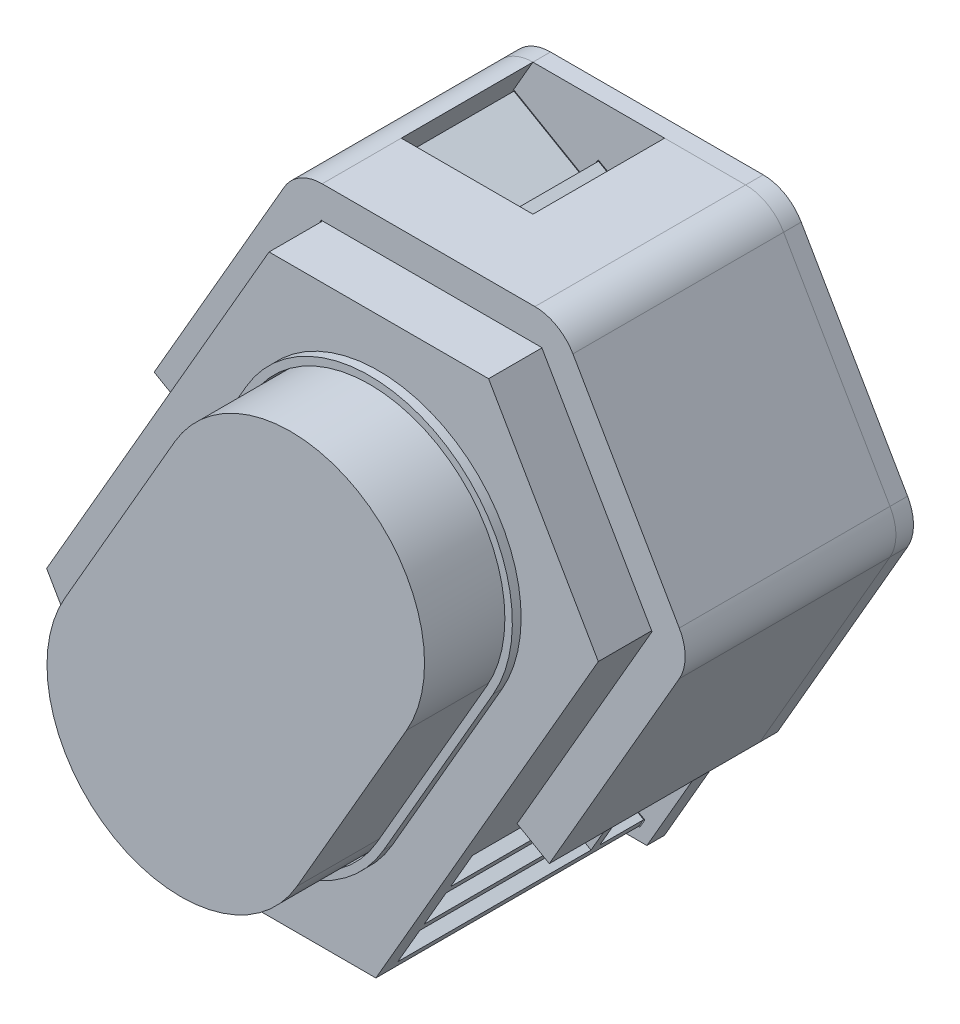
from build123d import *

# Parameters (mm, degrees)
BOSS_EXTRUDE1_DEPTH         = 60
SHELL1_T                    = -3
CUT_EXTRUDE1_REACH          = 436.199
SKETCH9_W                   = 10
SKETCH9_H                   = 44
SKETCH9_H_2                 = 10
CUT_EXTRUDE2_REACH          = 317.512
SKETCH10_W                  = 10
SKETCH10_H                  = 44
SKETCH10_H_2                = 10
CUT_EXTRUDE3_REACH          = 238.706
SKETCH11_W                  = 10
SKETCH11_H                  = 44
SKETCH11_H_2                = 10
BOSS_EXTRUDE8_START         = -60
BOSS_EXTRUDE8_DEPTH         = 48
FILLET2_R                   = 10
MOVE_FACE2_DEPTH            = 48
BOSS_EXTRUDE6_DEPTH         = 2
CUT_EXTRUDE4_DEPTH          = 30
MOVE_FACE3_BY               = 0.2
BOSS_EXTRUDE9_REACH         = 441.997
MOVE_FACE4_BY               = 0.2
MOVE_FACE5_BY               = 27
BOSS_EXTRUDE7_DEPTH         = 18
BOSS_EXTRUDE7_DEPTH_BACK    = 62
BODY_MOVE_COPY2_DEPTH       = 80
MOVE_START                  = -0.3
MOVE_FACE1_DEPTH            = 80.6
SHELL4_DEPTH                = 77
BOSS_EXTRUDE10_DEPTH        = 4
FILLET3_R                   = 10
MOVE_START_2                = -4
MOVE_FACE6_DEPTH            = 4
BOSS_EXTRUDE11_DEPTH        = 2
BOSS_EXTRUDE11_2_DEPTH      = 2
BOSS_EXTRUDE11_3_OUTLINE_W  = 2
BOSS_EXTRUDE11_3_OUTLINE_H  = 3
BOSS_EXTRUDE11_3_DEPTH      = 2
BOSS_EXTRUDE11_4_DEPTH      = 2
BOSS_EXTRUDE11_5_DEPTH      = 2
BOSS_EXTRUDE11_6_DEPTH      = 2
BOSS_EXTRUDE11_7_DEPTH      = 2
BOSS_EXTRUDE11_8_DEPTH      = 2
BOSS_EXTRUDE11_9_DEPTH      = 2
BOSS_EXTRUDE11_10_DEPTH     = 2
BOSS_EXTRUDE11_11_OUTLINE_W = 2
BOSS_EXTRUDE11_11_OUTLINE_H = 3
BOSS_EXTRUDE11_11_DEPTH     = 2
BOSS_EXTRUDE11_12_OUTLINE_W = 2
BOSS_EXTRUDE11_12_OUTLINE_H = 3
BOSS_EXTRUDE11_12_DEPTH     = 2
BOSS_EXTRUDE11_13_DEPTH     = 2
BOSS_EXTRUDE11_14_DEPTH     = 2
BOSS_EXTRUDE11_15_DEPTH     = 2
MOVE_START_3                = -315.983573027
MOVE_FACE7_OUTLINE_W        = 3.4
MOVE_FACE7_OUTLINE_H        = 2
MOVE_FACE7_DEPTH            = 2.4
MOVE_START_4                = -2
MOVE_FACE7_2_DEPTH          = 2
MOVE_START_5                = -150.955362411
MOVE_FACE7_3_OUTLINE_W      = 3.4
MOVE_FACE7_3_OUTLINE_H      = 2
MOVE_FACE7_3_DEPTH          = 2.4
MOVE_START_6                = -13.898877476
MOVE_FACE7_4_OUTLINE_W      = 2.4
MOVE_FACE7_4_OUTLINE_H      = 2
MOVE_FACE7_4_DEPTH          = 3.4
MOVE_START_7                = -339.983573027
MOVE_FACE7_5_OUTLINE_W      = 3.4
MOVE_FACE7_5_OUTLINE_H      = 2
MOVE_FACE7_5_DEPTH          = 2.4
MOVE_FACE7_6_DEPTH          = 2
MOVE_START_8                = 175.828210615
MOVE_FACE7_7_OUTLINE_W      = 3.4
MOVE_FACE7_7_OUTLINE_H      = 2
MOVE_FACE7_7_DEPTH          = 2.4
MOVE_START_9                = -311.702949613
MOVE_FACE7_8_OUTLINE_W      = 2.4
MOVE_FACE7_8_OUTLINE_H      = 2
MOVE_FACE7_8_DEPTH          = 3.4
MOVE_FACE7_9_DEPTH          = 2
MOVE_FACE7_10_DEPTH         = 2
MOVE_START_10               = -138.955362411
MOVE_FACE7_11_OUTLINE_W     = 3.4
MOVE_FACE7_11_OUTLINE_H     = 2
MOVE_FACE7_11_DEPTH         = 2.4
MOVE_START_11               = -126.955362411
MOVE_FACE7_12_OUTLINE_W     = 3.4
MOVE_FACE7_12_OUTLINE_H     = 2
MOVE_FACE7_12_DEPTH         = 2.4
MOVE_FACE7_13_DEPTH         = 2
MOVE_FACE7_14_OUTLINE_W     = 3.4
MOVE_FACE7_14_OUTLINE_H     = 2
MOVE_FACE7_14_DEPTH         = 2.4
MOVE_START_12               = -228.100409235
MOVE_FACE7_15_OUTLINE_W     = 2.4
MOVE_FACE7_15_OUTLINE_H     = 2
MOVE_FACE7_15_DEPTH         = 3.4


# Read off the part's stored shape, not the designer's step: Boss-Extrude8, Move Face2, Body-Move/Copy2, Move Face1, Shell4, Move Face6, Boss-Extrude11, Move Face7
with BuildPart() as part:
    # Sketch1 → Boss-Extrude1 (new body)
    with BuildSketch(Plane(origin=(0, 0, 0), x_dir=(0, 1, 0), z_dir=(0, 0, 1))):
        Polygon((254.502801948, 162.755362411), (297.804072137, 187.755362411), (332.445088288, 167.755362411), (385.566866553, 137.08548943), (385.566866553, 87.08548943), (342.265596364, 62.08548943), (289.143818099, 92.755362411), (254.502801948, 112.755362411), align=None)
    extrude(amount=BOSS_EXTRUDE1_DEPTH)

    # Shell1
    shell1_openings = [part.faces().sort_by_distance(p)[0] for p in [
        (-124.920425921, 320.03483425, 0),
    ]]
    offset(amount=SHELL1_T, openings=shell1_openings, kind=Kind.INTERSECTION)

    # Sketch9 → Cut-Extrude1 (cut, up to next)
    with BuildSketch(Plane(origin=(-11.863575898, -6.849438738, 0), x_dir=(0.5000000000000064, -0.8660254037844349, 0), z_dir=(-0.8660254037844349, -0.5000000000000064, 0)), mode=Mode.PRIVATE) as cut_extrude1_sk1:
        with Locations((-344.783573027, 34)):
            Rectangle(SKETCH9_W, SKETCH9_H)
    cut_extrude1_tool1 = extrude(cut_extrude1_sk1.sketch, amount=-CUT_EXTRUDE1_REACH, mode=Mode.PRIVATE) & part.part
    # Sketch9 → Cut-Extrude1 (cut, up to next)
    with BuildSketch(Plane(origin=(-11.863575898, -6.849438738, 0), x_dir=(0.5000000000000064, -0.8660254037844349, 0), z_dir=(-0.8660254037844349, -0.5000000000000064, 0)), mode=Mode.PRIVATE) as cut_extrude1_sk2:
        with Locations((-332.783573027, 34)):
            Rectangle(SKETCH9_W, SKETCH9_H)
    cut_extrude1_tool2 = extrude(cut_extrude1_sk2.sketch, amount=-CUT_EXTRUDE1_REACH, mode=Mode.PRIVATE) & part.part
    # Sketch9 → Cut-Extrude1 (cut, up to next)
    with BuildSketch(Plane(origin=(-11.863575898, -6.849438738, 0), x_dir=(0.5000000000000064, -0.8660254037844349, 0), z_dir=(-0.8660254037844349, -0.5000000000000064, 0)), mode=Mode.PRIVATE) as cut_extrude1_sk3:
        with Locations((-320.783573027, 34)):
            Rectangle(SKETCH9_W, SKETCH9_H)
    cut_extrude1_tool3 = extrude(cut_extrude1_sk3.sketch, amount=-CUT_EXTRUDE1_REACH, mode=Mode.PRIVATE) & part.part
    # Sketch9 → Cut-Extrude1 (cut, up to next)
    with BuildSketch(Plane(origin=(-11.863575898, -6.849438738, 0), x_dir=(0.5000000000000064, -0.8660254037844349, 0), z_dir=(-0.8660254037844349, -0.5000000000000064, 0)), mode=Mode.PRIVATE) as cut_extrude1_sk4:
        with Locations((-308.783573027, 34)):
            Rectangle(SKETCH9_W, SKETCH9_H)
    cut_extrude1_tool4 = extrude(cut_extrude1_sk4.sketch, amount=-CUT_EXTRUDE1_REACH, mode=Mode.PRIVATE) & part.part
    # Sketch9 → Cut-Extrude1 (cut, up to next)
    with BuildSketch(Plane(origin=(-11.863575898, -6.849438738, 0), x_dir=(0.5000000000000064, -0.8660254037844349, 0), z_dir=(-0.8660254037844349, -0.5000000000000064, 0)), mode=Mode.PRIVATE) as cut_extrude1_sk5:
        with Locations((-344.783573027, 5)):
            Rectangle(SKETCH9_W, SKETCH9_H_2)
    cut_extrude1_tool5 = extrude(cut_extrude1_sk5.sketch, amount=-CUT_EXTRUDE1_REACH, mode=Mode.PRIVATE) & part.part
    # Sketch9 → Cut-Extrude1 (cut, up to next)
    with BuildSketch(Plane(origin=(-11.863575898, -6.849438738, 0), x_dir=(0.5000000000000064, -0.8660254037844349, 0), z_dir=(-0.8660254037844349, -0.5000000000000064, 0)), mode=Mode.PRIVATE) as cut_extrude1_sk6:
        with Locations((-332.783573027, 5)):
            Rectangle(SKETCH9_W, SKETCH9_H_2)
    cut_extrude1_tool6 = extrude(cut_extrude1_sk6.sketch, amount=-CUT_EXTRUDE1_REACH, mode=Mode.PRIVATE) & part.part
    # Sketch9 → Cut-Extrude1 (cut, up to next)
    with BuildSketch(Plane(origin=(-11.863575898, -6.849438738, 0), x_dir=(0.5000000000000064, -0.8660254037844349, 0), z_dir=(-0.8660254037844349, -0.5000000000000064, 0)), mode=Mode.PRIVATE) as cut_extrude1_sk7:
        with Locations((-320.783573027, 5)):
            Rectangle(SKETCH9_W, SKETCH9_H_2)
    cut_extrude1_tool7 = extrude(cut_extrude1_sk7.sketch, amount=-CUT_EXTRUDE1_REACH, mode=Mode.PRIVATE) & part.part
    # Sketch9 → Cut-Extrude1 (cut, up to next)
    with BuildSketch(Plane(origin=(-11.863575898, -6.849438738, 0), x_dir=(0.5000000000000064, -0.8660254037844349, 0), z_dir=(-0.8660254037844349, -0.5000000000000064, 0)), mode=Mode.PRIVATE) as cut_extrude1_sk8:
        with Locations((-308.783573027, 5)):
            Rectangle(SKETCH9_W, SKETCH9_H_2)
    cut_extrude1_tool8 = extrude(cut_extrude1_sk8.sketch, amount=-CUT_EXTRUDE1_REACH, mode=Mode.PRIVATE) & part.part
    add(cut_extrude1_tool1.solids().sort_by_distance((-184.255362, 291.741894, 34))[0], mode=Mode.SUBTRACT)
    add(cut_extrude1_tool2.solids().sort_by_distance((-178.255362, 281.349589, 34))[0], mode=Mode.SUBTRACT)
    add(cut_extrude1_tool3.solids().sort_by_distance((-172.255362, 270.957285, 34))[0], mode=Mode.SUBTRACT)
    add(cut_extrude1_tool4.solids().sort_by_distance((-166.255362, 260.56498, 34))[0], mode=Mode.SUBTRACT)
    add(cut_extrude1_tool5.solids().sort_by_distance((-184.255362, 291.741894, 5))[0], mode=Mode.SUBTRACT)
    add(cut_extrude1_tool6.solids().sort_by_distance((-178.255362, 281.349589, 5))[0], mode=Mode.SUBTRACT)
    add(cut_extrude1_tool7.solids().sort_by_distance((-172.255362, 270.957285, 5))[0], mode=Mode.SUBTRACT)
    add(cut_extrude1_tool8.solids().sort_by_distance((-166.255362, 260.56498, 5))[0], mode=Mode.SUBTRACT)

    # Cut-Extrude2: up to this face of the body (flat: up to its plane)
    cut_extrude2_end = Plane(part.part.faces().sort_by_distance((-87.420425921, 298.384199156, 30))[0])
    # Sketch10 → Cut-Extrude2 (cut, up to the picked face)
    with BuildSketch(Plane(origin=(-269.769467719, 155.751474807, 0), x_dir=(-0.4999999999999934, -0.8660254037844425, 0), z_dir=(-0.8660254037844424, 0.49999999999999334, 0)), mode=Mode.PRIVATE) as cut_extrude2_sk1:
        with Locations((-195.028210615, 34)):
            Rectangle(SKETCH10_W, SKETCH10_H)
    cut_extrude2_tool1 = split(extrude(cut_extrude2_sk1.sketch, amount=-CUT_EXTRUDE2_REACH, mode=Mode.PRIVATE), bisect_by=cut_extrude2_end, keep=Keep.BOTH, mode=Mode.PRIVATE)
    # Sketch10 → Cut-Extrude2 (cut, up to the picked face)
    with BuildSketch(Plane(origin=(-269.769467719, 155.751474807, 0), x_dir=(-0.4999999999999934, -0.8660254037844425, 0), z_dir=(-0.8660254037844424, 0.49999999999999334, 0)), mode=Mode.PRIVATE) as cut_extrude2_sk2:
        with Locations((-183.028210615, 34)):
            Rectangle(SKETCH10_W, SKETCH10_H)
    cut_extrude2_tool2 = split(extrude(cut_extrude2_sk2.sketch, amount=-CUT_EXTRUDE2_REACH, mode=Mode.PRIVATE), bisect_by=cut_extrude2_end, keep=Keep.BOTH, mode=Mode.PRIVATE)
    # Sketch10 → Cut-Extrude2 (cut, up to the picked face)
    with BuildSketch(Plane(origin=(-269.769467719, 155.751474807, 0), x_dir=(-0.4999999999999934, -0.8660254037844425, 0), z_dir=(-0.8660254037844424, 0.49999999999999334, 0)), mode=Mode.PRIVATE) as cut_extrude2_sk3:
        with Locations((-171.028210615, 34)):
            Rectangle(SKETCH10_W, SKETCH10_H)
    cut_extrude2_tool3 = split(extrude(cut_extrude2_sk3.sketch, amount=-CUT_EXTRUDE2_REACH, mode=Mode.PRIVATE), bisect_by=cut_extrude2_end, keep=Keep.BOTH, mode=Mode.PRIVATE)
    # Sketch10 → Cut-Extrude2 (cut, up to the picked face)
    with BuildSketch(Plane(origin=(-269.769467719, 155.751474807, 0), x_dir=(-0.4999999999999934, -0.8660254037844425, 0), z_dir=(-0.8660254037844424, 0.49999999999999334, 0)), mode=Mode.PRIVATE) as cut_extrude2_sk4:
        with Locations((-195.028210615, 5)):
            Rectangle(SKETCH10_W, SKETCH10_H_2)
    cut_extrude2_tool4 = split(extrude(cut_extrude2_sk4.sketch, amount=-CUT_EXTRUDE2_REACH, mode=Mode.PRIVATE), bisect_by=cut_extrude2_end, keep=Keep.BOTH, mode=Mode.PRIVATE)
    # Sketch10 → Cut-Extrude2 (cut, up to the picked face)
    with BuildSketch(Plane(origin=(-269.769467719, 155.751474807, 0), x_dir=(-0.4999999999999934, -0.8660254037844425, 0), z_dir=(-0.8660254037844424, 0.49999999999999334, 0)), mode=Mode.PRIVATE) as cut_extrude2_sk5:
        with Locations((-183.028210615, 5)):
            Rectangle(SKETCH10_W, SKETCH10_H_2)
    cut_extrude2_tool5 = split(extrude(cut_extrude2_sk5.sketch, amount=-CUT_EXTRUDE2_REACH, mode=Mode.PRIVATE), bisect_by=cut_extrude2_end, keep=Keep.BOTH, mode=Mode.PRIVATE)
    # Sketch10 → Cut-Extrude2 (cut, up to the picked face)
    with BuildSketch(Plane(origin=(-269.769467719, 155.751474807, 0), x_dir=(-0.4999999999999934, -0.8660254037844425, 0), z_dir=(-0.8660254037844424, 0.49999999999999334, 0)), mode=Mode.PRIVATE) as cut_extrude2_sk6:
        with Locations((-171.028210615, 5)):
            Rectangle(SKETCH10_W, SKETCH10_H_2)
    cut_extrude2_tool6 = split(extrude(cut_extrude2_sk6.sketch, amount=-CUT_EXTRUDE2_REACH, mode=Mode.PRIVATE), bisect_by=cut_extrude2_end, keep=Keep.BOTH, mode=Mode.PRIVATE)
    add(cut_extrude2_tool1.solids().sort_by(Axis((-172.255362, 324.65086, 34), (0.8660254037844424, -0.49999999999999334, 0)))[0], mode=Mode.SUBTRACT)
    add(cut_extrude2_tool2.solids().sort_by(Axis((-178.255362, 314.258555, 34), (0.8660254037844424, -0.49999999999999334, 0)))[0], mode=Mode.SUBTRACT)
    add(cut_extrude2_tool3.solids().sort_by(Axis((-184.255362, 303.86625, 34), (0.8660254037844424, -0.49999999999999334, 0)))[0], mode=Mode.SUBTRACT)
    add(cut_extrude2_tool4.solids().sort_by(Axis((-172.255362, 324.65086, 5), (0.8660254037844424, -0.49999999999999334, 0)))[0], mode=Mode.SUBTRACT)
    add(cut_extrude2_tool5.solids().sort_by(Axis((-178.255362, 314.258555, 5), (0.8660254037844424, -0.49999999999999334, 0)))[0], mode=Mode.SUBTRACT)
    add(cut_extrude2_tool6.solids().sort_by(Axis((-184.255362, 303.86625, 5), (0.8660254037844424, -0.49999999999999334, 0)))[0], mode=Mode.SUBTRACT)

    # Sketch11 → Cut-Extrude3 (cut, up to next)
    with BuildSketch(Plane.XZ.offset(-254.502801948), mode=Mode.PRIVATE) as cut_extrude3_sk1:
        with Locations((-155.755362411, 34)):
            Rectangle(SKETCH11_W, SKETCH11_H)
    cut_extrude3_tool1 = extrude(cut_extrude3_sk1.sketch, amount=-CUT_EXTRUDE3_REACH, mode=Mode.PRIVATE) & part.part
    # Sketch11 → Cut-Extrude3 (cut, up to next)
    with BuildSketch(Plane.XZ.offset(-254.502801948), mode=Mode.PRIVATE) as cut_extrude3_sk2:
        with Locations((-143.755362411, 34)):
            Rectangle(SKETCH11_W, SKETCH11_H)
    cut_extrude3_tool2 = extrude(cut_extrude3_sk2.sketch, amount=-CUT_EXTRUDE3_REACH, mode=Mode.PRIVATE) & part.part
    # Sketch11 → Cut-Extrude3 (cut, up to next)
    with BuildSketch(Plane.XZ.offset(-254.502801948), mode=Mode.PRIVATE) as cut_extrude3_sk3:
        with Locations((-131.755362411, 34)):
            Rectangle(SKETCH11_W, SKETCH11_H)
    cut_extrude3_tool3 = extrude(cut_extrude3_sk3.sketch, amount=-CUT_EXTRUDE3_REACH, mode=Mode.PRIVATE) & part.part
    # Sketch11 → Cut-Extrude3 (cut, up to next)
    with BuildSketch(Plane.XZ.offset(-254.502801948), mode=Mode.PRIVATE) as cut_extrude3_sk4:
        with Locations((-119.755362411, 34)):
            Rectangle(SKETCH11_W, SKETCH11_H)
    cut_extrude3_tool4 = extrude(cut_extrude3_sk4.sketch, amount=-CUT_EXTRUDE3_REACH, mode=Mode.PRIVATE) & part.part
    # Sketch11 → Cut-Extrude3 (cut, up to next)
    with BuildSketch(Plane.XZ.offset(-254.502801948), mode=Mode.PRIVATE) as cut_extrude3_sk5:
        with Locations((-155.755362411, 5)):
            Rectangle(SKETCH11_W, SKETCH11_H_2)
    cut_extrude3_tool5 = extrude(cut_extrude3_sk5.sketch, amount=-CUT_EXTRUDE3_REACH, mode=Mode.PRIVATE) & part.part
    # Sketch11 → Cut-Extrude3 (cut, up to next)
    with BuildSketch(Plane.XZ.offset(-254.502801948), mode=Mode.PRIVATE) as cut_extrude3_sk6:
        with Locations((-143.755362411, 5)):
            Rectangle(SKETCH11_W, SKETCH11_H_2)
    cut_extrude3_tool6 = extrude(cut_extrude3_sk6.sketch, amount=-CUT_EXTRUDE3_REACH, mode=Mode.PRIVATE) & part.part
    # Sketch11 → Cut-Extrude3 (cut, up to next)
    with BuildSketch(Plane.XZ.offset(-254.502801948), mode=Mode.PRIVATE) as cut_extrude3_sk7:
        with Locations((-131.755362411, 5)):
            Rectangle(SKETCH11_W, SKETCH11_H_2)
    cut_extrude3_tool7 = extrude(cut_extrude3_sk7.sketch, amount=-CUT_EXTRUDE3_REACH, mode=Mode.PRIVATE) & part.part
    # Sketch11 → Cut-Extrude3 (cut, up to next)
    with BuildSketch(Plane.XZ.offset(-254.502801948), mode=Mode.PRIVATE) as cut_extrude3_sk8:
        with Locations((-119.755362411, 5)):
            Rectangle(SKETCH11_W, SKETCH11_H_2)
    cut_extrude3_tool8 = extrude(cut_extrude3_sk8.sketch, amount=-CUT_EXTRUDE3_REACH, mode=Mode.PRIVATE) & part.part
    add(cut_extrude3_tool1.solids().sort_by_distance((-155.755362, 254.502802, 34))[0], mode=Mode.SUBTRACT)
    add(cut_extrude3_tool2.solids().sort_by_distance((-143.755362, 254.502802, 34))[0], mode=Mode.SUBTRACT)
    add(cut_extrude3_tool3.solids().sort_by_distance((-131.755362, 254.502802, 34))[0], mode=Mode.SUBTRACT)
    add(cut_extrude3_tool4.solids().sort_by_distance((-119.755362, 254.502802, 34))[0], mode=Mode.SUBTRACT)
    add(cut_extrude3_tool5.solids().sort_by_distance((-155.755362, 254.502802, 5))[0], mode=Mode.SUBTRACT)
    add(cut_extrude3_tool6.solids().sort_by_distance((-143.755362, 254.502802, 5))[0], mode=Mode.SUBTRACT)
    add(cut_extrude3_tool7.solids().sort_by_distance((-131.755362, 254.502802, 5))[0], mode=Mode.SUBTRACT)
    add(cut_extrude3_tool8.solids().sort_by_distance((-119.755362, 254.502802, 5))[0], mode=Mode.SUBTRACT)

    # Sketch6 → Boss-Extrude6 (add)
    with BuildSketch(Plane.XY.offset(60)):
        with BuildLine():
            Line((-165.317853327, 315.064435506), (-140.314646105, 358.371260766))
            ThreePointArc((-140.314646105, 358.371260766), (-95.918821836, 370.267086027), (-84.022996575, 325.871261757))
            Line((-84.022996575, 325.871261757), (-109.026203797, 282.564436497))
            ThreePointArc((-109.026203797, 282.564436497), (-153.422028067, 270.668611236), (-165.317853327, 315.064435506))
        make_face()
    extrude(amount=BOSS_EXTRUDE6_DEPTH)


with BuildPart() as body_2:
    # Boss-Extrude8 outline → Boss-Extrude8 (new body)
    with BuildSketch(Plane.XY.offset(60).offset(BOSS_EXTRUDE8_START)):
        Polygon((-92.755362411, 289.143818099), (-85.255362411, 284.81369108), (-52.755362411, 341.105342326), (-82.755362411, 393.066866553), (-142.755362411, 393.066866553), (-175.255362411, 336.775215307), (-167.755362411, 332.445088288), (-137.08548943, 385.566866553), (-87.08548943, 385.566866553), (-62.08548943, 342.265596364), align=None)
    extrude(amount=BOSS_EXTRUDE8_DEPTH)

    # Fillet2
    fillet2_edges = [body_2.edges().sort_by_distance(p)[0] for p in [
        (-142.755362411, 393.066866553, 24),
        (-82.755362411, 393.066866553, 24),
        (-52.755362411, 341.105342326, 24),
    ]]
    fillet(fillet2_edges, radius=FILLET2_R)

    # Move Face2 outline → Move Face2 (cut)
    with BuildSketch(Plane.XY):
        Polygon((-137.200959484, 385.766866553), (-167.928567492, 332.545088288), (-167.755362411, 332.445088288), (-137.08548943, 385.566866553), (-87.08548943, 385.566866553), (-62.08548943, 342.265596364), (-92.755362411, 289.143818099), (-92.58215733, 289.043818099), (-61.854549322, 342.265596364), (-86.970019376, 385.766866553), align=None)
    extrude(amount=MOVE_FACE2_DEPTH, mode=Mode.SUBTRACT)


with BuildPart() as cut_extrude4_tool:
    # Sketch12 → Cut-Extrude4 (new body)
    with BuildSketch(Plane(origin=(0, 0, 0), x_dir=(1, 0, 0), z_dir=(0, 0, -1))):
        Polygon((-136.981859719, -393.066866553), (-106.981859719, -393.066866553), (-120.981859719, -368.818155247), (-143.481859719, -381.808536304), align=None)
    extrude(amount=-CUT_EXTRUDE4_DEPTH)


with BuildPart() as part_1:
    add(part.part)

    # Cut-Extrude4: cut by cut_extrude4_tool
    add(cut_extrude4_tool.part, mode=Mode.SUBTRACT)

    # Boss-Extrude9: up to this face of the body (flat: up to its plane)
    boss_extrude9_end = Plane(part_1.part.faces().sort_by_distance((-124.920425921, 320.03483425, 57))[0])
    # Sketch14 → Boss-Extrude9 (add, up to the picked face)
    with BuildSketch(Plane(origin=(0, 0, 0), x_dir=(1, 0, 0), z_dir=(0, 0, -1)), mode=Mode.PRIVATE) as boss_extrude9_sk1:
        Polygon((-120.945961334, -376.880333074), (-114.883783508, -373.380333074), (-109.579935931, -382.566866553), (-113.044037546, -382.566866553), (-115.981859719, -377.478409285), (-122.044037546, -380.978409285), (-125.044037546, -375.782256862), (-141.481859719, -385.272637919), (-143.481859719, -381.808536304), (-124.445961334, -370.818155247), align=None)
    boss_extrude9_tool1 = split(extrude(boss_extrude9_sk1.sketch, amount=-BOSS_EXTRUDE9_REACH, mode=Mode.PRIVATE), bisect_by=boss_extrude9_end, keep=Keep.BOTH, mode=Mode.PRIVATE)
    add(boss_extrude9_tool1.solids().sort_by(Axis((-117.730599, 375.449505, 0), (0, 0, 1)))[0])

    # Move Face4: a face moved inward by 0.2
    extrude(part_1.faces().sort_by_distance((-142.481859719, 383.540587112, 28.5))[0], amount=MOVE_FACE4_BY, dir=(0.866025404, -0.5, 0), mode=Mode.SUBTRACT)

    # Move Face5: a face moved inward by 27.0
    extrude(part_1.faces().sort_by_distance((-140.810320688, 382.575523602, 57))[0], amount=MOVE_FACE5_BY, dir=(0, 0, -1), mode=Mode.SUBTRACT)


with BuildPart() as body_2_1:
    add(body_2.part)

    # Cut-Extrude4: cut by cut_extrude4_tool
    add(cut_extrude4_tool.part, mode=Mode.SUBTRACT)

    # Move Face3: a face moved inward by 0.2
    extrude(body_2_1.faces().sort_by_distance((-141.983525769, 380.943472795, 15))[0], amount=MOVE_FACE3_BY, dir=(-0.5, -0.866025404, 0), mode=Mode.SUBTRACT)


with BuildPart() as body_3:
    # Sketch8 → Boss-Extrude7 (new, two sides: drawn at the far end of the back side and taken through both)
    with BuildSketch(Plane.XY.offset(62).offset(-BOSS_EXTRUDE7_DEPTH_BACK)):
        with BuildLine():
            Line((-163.58360208, 314.060217105), (-138.584016626, 357.369133193))
            ThreePointArc((-138.584016626, 357.369133193), (-96.921176918, 368.536391882), (-85.75391823, 326.873552174))
            Line((-85.75391823, 326.873552174), (-110.753503684, 283.564636086))
            ThreePointArc((-110.753503684, 283.564636086), (-152.416343391, 272.397377398), (-163.58360208, 314.060217105))
        make_face()
    extrude(amount=BOSS_EXTRUDE7_DEPTH + BOSS_EXTRUDE7_DEPTH_BACK)

    # Shell4 outline → Shell4 (cut)
    with BuildSketch(Plane.XY):
        with BuildLine():
            ThreePointArc((-160.985400435, 312.560434384), (-150.91656067, 274.995579043), (-113.351705329, 285.064418808))
            Line((-113.351705329, 285.064418808), (-88.352119875, 328.373334896))
            ThreePointArc((-88.352119875, 328.373334896), (-98.42095964, 365.938190237), (-135.985814981, 355.869350471))
            Line((-135.985814981, 355.869350471), (-160.985400435, 312.560434384))
        make_face()
    extrude(amount=SHELL4_DEPTH, mode=Mode.SUBTRACT)


with BuildPart() as body_4:
    # Body-Move/Copy2 outline → Body-Move/Copy2 (new body)
    with BuildSketch(Plane.XY):
        with BuildLine():
            ThreePointArc((-163.58360208, 314.060217105), (-152.416343391, 272.397377398), (-110.753503684, 283.564636086))
            Line((-110.753503684, 283.564636086), (-85.75391823, 326.873552174))
            ThreePointArc((-85.75391823, 326.873552174), (-96.921176918, 368.536391882), (-138.584016626, 357.369133193))
            Line((-138.584016626, 357.369133193), (-163.58360208, 314.060217105))
        make_face()
    extrude(amount=BODY_MOVE_COPY2_DEPTH)

    # Move Face1 outline → Move Face1 (add)
    with BuildSketch(Plane.XY.offset(MOVE_START)):
        with BuildLine():
            ThreePointArc((-163.843422244, 314.210195378), (-152.566321664, 272.137557233), (-110.493683519, 283.414657814))
            Line((-110.493683519, 283.414657814), (-85.494098065, 326.723573902))
            ThreePointArc((-85.494098065, 326.723573902), (-96.771198646, 368.796212046), (-138.84383679, 357.519111465))
            Line((-138.84383679, 357.519111465), (-163.843422244, 314.210195378))
        make_face()
    extrude(amount=MOVE_FACE1_DEPTH)


with BuildPart() as part_2:
    add(part_1.part)

    # Combine4: cut body 4
    add(body_4.part, mode=Mode.SUBTRACT)


with BuildPart() as body_4_2:
    # Sketch15 → Boss-Extrude10 (new body)
    with BuildSketch(Plane(origin=(0, 0, 0), x_dir=(1, 0, 0), z_dir=(0, 0, -1))):
        Polygon((-162.755362411, -254.502801948), (-112.755362411, -254.502801948), (-92.755362411, -289.143818099), (-85.255362411, -284.81369108), (-52.755362411, -341.105342326), (-82.755362411, -393.066866553), (-142.755362411, -393.066866553), (-175.255362411, -336.775215307), (-167.928567492, -332.545088288), (-187.755362411, -297.804072137), align=None)
    extrude(amount=BOSS_EXTRUDE10_DEPTH)

    # Fillet3
    fillet3_edges = [body_4_2.edges().sort_by_distance(p)[0] for p in [
        (-52.755362411, 341.105342326, -2),
        (-82.755362411, 393.066866553, -2),
        (-142.755362411, 393.066866553, -2),
    ]]
    fillet(fillet3_edges, radius=FILLET3_R)

    # Move Face6 outline → Move Face6 (add)
    with BuildSketch(Plane.XY.offset(MOVE_START_2)):
        Polygon((-191.214471264, 297.795424419), (-164.487413219, 251.502801948), (-111.023311604, 251.502801948), (-90.1572862, 287.643818099), (-92.755362411, 289.143818099), (-112.755362411, 254.502801948), (-162.755362411, 254.502801948), (-187.755362411, 297.804072137), (-167.928567492, 332.545088288), (-170.526676179, 334.045107038), align=None)
    extrude(amount=MOVE_FACE6_DEPTH)


with BuildPart() as body_5:
    # Boss-Extrude11 outline → Boss-Extrude11 (new body)
    with BuildSketch(Plane(origin=(0, 0, 0), x_dir=(1, 0, 0), z_dir=(0, 0, -1))):
        Polygon((-166.1572862, -266.395106793), (-168.755362411, -264.895106793), (-169.755362411, -266.627157601), (-167.1572862, -268.127157601), align=None)
    extrude(amount=BOSS_EXTRUDE11_DEPTH)

    # Move Face7 outline → Move Face7 (add)
    with BuildSketch(Plane(origin=(0, 0, 0), x_dir=(0.8660254037844269, 0.5000000000000201, 0), z_dir=(0.5000000000000201, -0.8660254037844272, 0)).offset(MOVE_START_3)):
        with Locations((-12.198877476, -1)):
            Rectangle(MOVE_FACE7_OUTLINE_W, MOVE_FACE7_OUTLINE_H)
    extrude(amount=MOVE_FACE7_DEPTH)


with BuildPart() as body_6:
    # Boss-Extrude11 2 outline → Boss-Extrude11 2 (new body)
    with BuildSketch(Plane(origin=(0, 0, 0), x_dir=(1, 0, 0), z_dir=(0, 0, -1))):
        Polygon((-163.755362411, -256.234852755), (-161.1572862, -257.734852755), (-161.023311604, -257.502801948), (-160.755362411, -257.502801948), (-160.755362411, -254.502801948), (-162.755362411, -254.502801948), align=None)
    extrude(amount=BOSS_EXTRUDE11_2_DEPTH)

    # Move Face7 2 outline → Move Face7 2 (add)
    with BuildSketch(Plane.XY.offset(MOVE_START_4)):
        Polygon((-161.084081119, 258.008057836), (-164.028567492, 256.308057836), (-162.870832465, 254.302801948), (-160.555362411, 254.302801948), (-160.555362411, 257.502801948), (-160.755362411, 257.502801948), (-160.755362411, 254.502801948), (-162.755362411, 254.502801948), (-163.755362411, 256.234852755), (-161.1572862, 257.734852755), (-161.023311604, 257.502801948), (-160.792371496, 257.502801948), align=None)
    extrude(amount=MOVE_FACE7_2_DEPTH)


with BuildPart() as body_7:
    # Boss-Extrude11 3 outline → Boss-Extrude11 3 (new body)
    with BuildSketch(Plane(origin=(0, 0, 0), x_dir=(1, 0, 0), z_dir=(0, 0, -1))):
        with Locations((-149.755362411, -256.002801948)):
            Rectangle(BOSS_EXTRUDE11_3_OUTLINE_W, BOSS_EXTRUDE11_3_OUTLINE_H)
    extrude(amount=BOSS_EXTRUDE11_3_DEPTH)

    # Move Face7 3 outline → Move Face7 3 (add)
    with BuildSketch(Plane.YZ.offset(MOVE_START_5)):
        with Locations((256.002801948, -1)):
            Rectangle(MOVE_FACE7_3_OUTLINE_W, MOVE_FACE7_3_OUTLINE_H)
    extrude(amount=MOVE_FACE7_3_DEPTH)


with BuildPart() as body_8:
    # Boss-Extrude11 4 outline → Boss-Extrude11 4 (new body)
    with BuildSketch(Plane(origin=(0, 0, 0), x_dir=(1, 0, 0), z_dir=(0, 0, -1))):
        Polygon((-173.1572862, -278.519462446), (-172.1572862, -276.787411638), (-174.755362411, -275.287411638), (-175.755362411, -277.019462446), align=None)
    extrude(amount=BOSS_EXTRUDE11_4_DEPTH)

    # Move Face7 4 outline → Move Face7 4 (add)
    with BuildSketch(Plane(origin=(0, 0, 0), x_dir=(0.49999999999998057, -0.8660254037844499, 0), z_dir=(0.8660254037844498, 0.49999999999998085, 0)).offset(MOVE_START_6)):
        with Locations((-326.783573027, 1)):
            Rectangle(MOVE_FACE7_4_OUTLINE_W, MOVE_FACE7_4_OUTLINE_H)
    extrude(amount=MOVE_FACE7_4_DEPTH)


with BuildPart() as body_9:
    # Boss-Extrude11 5 outline → Boss-Extrude11 5 (new body)
    with BuildSketch(Plane(origin=(0, 0, 0), x_dir=(1, 0, 0), z_dir=(0, 0, -1))):
        Polygon((-178.1572862, -287.179716484), (-180.755362411, -285.679716484), (-181.755362411, -287.411767291), (-179.1572862, -288.911767291), align=None)
    extrude(amount=BOSS_EXTRUDE11_5_DEPTH)

    # Move Face7 5 outline → Move Face7 5 (add)
    with BuildSketch(Plane(origin=(0, 0, 0), x_dir=(0.8660254037844269, 0.5000000000000201, 0), z_dir=(0.5000000000000201, -0.8660254037844272, 0)).offset(MOVE_START_7)):
        with Locations((-12.198877476, -1)):
            Rectangle(MOVE_FACE7_5_OUTLINE_W, MOVE_FACE7_5_OUTLINE_H)
    extrude(amount=MOVE_FACE7_5_DEPTH)


with BuildPart() as body_10:
    # Boss-Extrude11 6 outline → Boss-Extrude11 6 (new body)
    with BuildSketch(Plane(origin=(0, 0, 0), x_dir=(1, 0, 0), z_dir=(0, 0, -1))):
        Polygon((-186.755362411, -296.072021329), (-187.755362411, -297.804072137), (-186.755362411, -299.536122944), (-184.1572862, -298.036122944), (-184.291260796, -297.804072137), (-184.1572862, -297.572021329), align=None)
    extrude(amount=BOSS_EXTRUDE11_6_DEPTH)

    # Move Face7 6 outline → Move Face7 6 (add)
    with BuildSketch(Plane.XY.offset(MOVE_START_4)):
        Polygon((-187.986302519, 297.804072137), (-186.828567492, 295.798816249), (-183.884081119, 297.498816249), (-184.060320688, 297.804072137), (-183.884081119, 298.109328025), (-186.828567492, 299.809328025), align=None)
        Polygon((-184.1572862, 297.572021329), (-186.755362411, 296.072021329), (-187.755362411, 297.804072137), (-186.755362411, 299.536122944), (-184.1572862, 298.036122944), (-184.291260796, 297.804072137), align=None, mode=Mode.SUBTRACT)
    extrude(amount=MOVE_FACE7_6_DEPTH)


with BuildPart() as body_11:
    # Boss-Extrude11 7 outline → Boss-Extrude11 7 (new body)
    with BuildSketch(Plane(origin=(0, 0, 0), x_dir=(1, 0, 0), z_dir=(0, 0, -1))):
        Polygon((-179.1572862, -306.696376982), (-181.755362411, -308.196376982), (-180.755362411, -309.92842779), (-178.1572862, -308.42842779), align=None)
    extrude(amount=BOSS_EXTRUDE11_7_DEPTH)

    # Move Face7 7 outline → Move Face7 7 (add)
    with BuildSketch(Plane(origin=(0, 0, 0), x_dir=(0.866025403784442, -0.49999999999999406, 0), z_dir=(0.49999999999999406, 0.8660254037844421, 0)).offset(MOVE_START_8)):
        with Locations((-310.002949613, 1)):
            Rectangle(MOVE_FACE7_7_OUTLINE_W, MOVE_FACE7_7_OUTLINE_H)
    extrude(amount=MOVE_FACE7_7_DEPTH)


with BuildPart() as body_12:
    # Boss-Extrude11 8 outline → Boss-Extrude11 8 (new body)
    with BuildSketch(Plane(origin=(0, 0, 0), x_dir=(1, 0, 0), z_dir=(0, 0, -1))):
        Polygon((-175.755362411, -318.588681828), (-174.755362411, -320.320732635), (-172.1572862, -318.820732635), (-173.1572862, -317.088681828), align=None)
    extrude(amount=BOSS_EXTRUDE11_8_DEPTH)

    # Move Face7 8 outline → Move Face7 8 (add)
    with BuildSketch(Plane(origin=(0, 0, 0), x_dir=(0.4999999999999985, 0.8660254037844396, 0), z_dir=(0.8660254037844395, -0.49999999999999867, 0)).offset(MOVE_START_9)):
        with Locations((189.028210615, -1)):
            Rectangle(MOVE_FACE7_8_OUTLINE_W, MOVE_FACE7_8_OUTLINE_H)
    extrude(amount=MOVE_FACE7_8_DEPTH)


with BuildPart() as body_13:
    # Boss-Extrude11 9 outline → Boss-Extrude11 9 (new body)
    with BuildSketch(Plane(origin=(0, 0, 0), x_dir=(1, 0, 0), z_dir=(0, 0, -1))):
        Polygon((-137.713910527, -378.478409285), (-167.1572862, -327.480986673), (-169.755362411, -328.980986673), (-140.311986738, -379.978409285), (-143.308654638, -381.708536304), (-141.308654638, -385.172637919), (-125.044037546, -375.782256862), (-122.044037546, -380.978409285), (-115.981859719, -377.478409285), (-111.311986738, -385.566866553), (-87.08548943, -385.566866553), (-62.08548943, -342.265596364), (-94.755362411, -285.679716484), (-97.353438622, -287.179716484), (-65.549591045, -342.265596364), (-88.817540238, -382.566866553), (-109.579935931, -382.566866553), (-114.883783508, -373.380333074), (-120.945961334, -376.880333074), (-124.445961334, -370.818155247), align=None)
    extrude(amount=BOSS_EXTRUDE11_9_DEPTH)

    # Move Face7 9 outline → Move Face7 9 (add)
    with BuildSketch(Plane.XY.offset(MOVE_START_4)):
        Polygon((-167.084081119, 327.207781592), (-137.640705446, 378.205204204), (-124.372756254, 370.544950166), (-120.872756254, 376.607127993), (-114.810578427, 373.107127993), (-109.464465877, 382.366866553), (-88.933010291, 382.366866553), (-65.780531153, 342.265596364), (-97.626643703, 287.106511403), (-94.68215733, 285.406511403), (-61.854549322, 342.265596364), (-86.970019376, 385.766866553), (-111.427456792, 385.766866553), (-116.0550648, 377.751614366), (-122.117242626, 381.251614366), (-125.117242626, 376.055461943), (-141.381859719, 385.445843), (-143.581859719, 381.635331223), (-140.585191819, 379.905204204), (-170.028567492, 328.907781592), align=None)
        Polygon((-124.445961334, 370.818155247), (-137.713910527, 378.478409285), (-167.1572862, 327.480986673), (-169.755362411, 328.980986673), (-140.311986738, 379.978409285), (-143.308654638, 381.708536304), (-141.308654638, 385.172637919), (-125.044037546, 375.782256862), (-122.044037546, 380.978409285), (-115.981859719, 377.478409285), (-111.311986738, 385.566866553), (-87.08548943, 385.566866553), (-62.08548943, 342.265596364), (-94.755362411, 285.679716484), (-97.353438622, 287.179716484), (-65.549591045, 342.265596364), (-88.817540238, 382.566866553), (-109.579935931, 382.566866553), (-114.883783508, 373.380333074), (-120.945961334, 376.880333074), align=None, mode=Mode.SUBTRACT)
    extrude(amount=MOVE_FACE7_9_DEPTH)


with BuildPart() as body_14:
    # Boss-Extrude11 10 outline → Boss-Extrude11 10 (new body)
    with BuildSketch(Plane(origin=(0, 0, 0), x_dir=(1, 0, 0), z_dir=(0, 0, -1))):
        with BuildLine():
            Line((-85.75391823, -326.873552174), (-110.753503684, -283.564636086))
            ThreePointArc((-110.753503684, -283.564636086), (-152.416343391, -272.397377398), (-163.58360208, -314.060217105))
            Line((-163.58360208, -314.060217105), (-138.584016626, -357.369133193))
            ThreePointArc((-138.584016626, -357.369133193), (-96.921176918, -368.536391882), (-85.75391823, -326.873552174))
        make_face()
        with BuildLine():
            Line((-113.351705329, -285.064418808), (-88.352119875, -328.373334896))
            ThreePointArc((-88.352119875, -328.373334896), (-98.42095964, -365.938190237), (-135.985814981, -355.869350471))
            Line((-135.985814981, -355.869350471), (-160.985400435, -312.560434384))
            ThreePointArc((-160.985400435, -312.560434384), (-150.91656067, -274.995579043), (-113.351705329, -285.064418808))
        make_face(mode=Mode.SUBTRACT)
    extrude(amount=BOSS_EXTRUDE11_10_DEPTH)

    # Move Face7 10 outline → Move Face7 10 (add)
    # profile 1 of 2: a face of its own
    with BuildSketch(Plane.XY.offset(MOVE_START_4)):
        with BuildLine():
            Line((-110.580290241, 283.464650572), (-85.580704787, 326.773566659))
            ThreePointArc((-85.580704787, 326.773566659), (-96.821191403, 368.709605325), (-138.757230069, 357.469118708))
            Line((-138.757230069, 357.469118708), (-163.756815523, 314.16020262))
            ThreePointArc((-163.756815523, 314.16020262), (-152.516328906, 272.224163955), (-110.580290241, 283.464650572))
        make_face()
        with BuildLine():
            ThreePointArc((-138.584016626, 357.369133193), (-96.921176918, 368.536391882), (-85.75391823, 326.873552174))
            Line((-85.75391823, 326.873552174), (-110.753503684, 283.564636086))
            ThreePointArc((-110.753503684, 283.564636086), (-152.416343391, 272.397377398), (-163.58360208, 314.060217105))
            Line((-163.58360208, 314.060217105), (-138.584016626, 357.369133193))
        make_face(mode=Mode.SUBTRACT)
    # profile 2 of 2: a face of its own
    with BuildSketch(Plane.XY.offset(MOVE_START_4)):
        with BuildLine():
            Line((-113.351705329, 285.064418808), (-88.352119875, 328.373334896))
            ThreePointArc((-88.352119875, 328.373334896), (-98.42095964, 365.938190237), (-135.985814981, 355.869350471))
            Line((-135.985814981, 355.869350471), (-160.985400435, 312.560434384))
            ThreePointArc((-160.985400435, 312.560434384), (-150.91656067, 274.995579043), (-113.351705329, 285.064418808))
        make_face()
        with BuildLine():
            ThreePointArc((-135.812601538, 355.769364956), (-98.520945155, 365.764976794), (-88.525333318, 328.473320411))
            Line((-88.525333318, 328.473320411), (-113.524918772, 285.164404323))
            ThreePointArc((-113.524918772, 285.164404323), (-150.816575155, 275.168792486), (-160.812186992, 312.460448869))
            Line((-160.812186992, 312.460448869), (-135.812601538, 355.769364956))
        make_face(mode=Mode.SUBTRACT)
    extrude(amount=MOVE_FACE7_10_DEPTH)


with BuildPart() as body_15:
    # Boss-Extrude11 11 outline → Boss-Extrude11 11 (new body)
    with BuildSketch(Plane(origin=(0, 0, 0), x_dir=(1, 0, 0), z_dir=(0, 0, -1))):
        with Locations((-137.755362411, -256.002801948)):
            Rectangle(BOSS_EXTRUDE11_11_OUTLINE_W, BOSS_EXTRUDE11_11_OUTLINE_H)
    extrude(amount=BOSS_EXTRUDE11_11_DEPTH)

    # Move Face7 11 outline → Move Face7 11 (add)
    with BuildSketch(Plane.YZ.offset(MOVE_START_10)):
        with Locations((256.002801948, -1)):
            Rectangle(MOVE_FACE7_11_OUTLINE_W, MOVE_FACE7_11_OUTLINE_H)
    extrude(amount=MOVE_FACE7_11_DEPTH)


with BuildPart() as body_16:
    # Boss-Extrude11 12 outline → Boss-Extrude11 12 (new body)
    with BuildSketch(Plane(origin=(0, 0, 0), x_dir=(1, 0, 0), z_dir=(0, 0, -1))):
        with Locations((-125.755362411, -256.002801948)):
            Rectangle(BOSS_EXTRUDE11_12_OUTLINE_W, BOSS_EXTRUDE11_12_OUTLINE_H)
    extrude(amount=BOSS_EXTRUDE11_12_DEPTH)

    # Move Face7 12 outline → Move Face7 12 (add)
    with BuildSketch(Plane.YZ.offset(MOVE_START_11)):
        with Locations((256.002801948, -1)):
            Rectangle(MOVE_FACE7_12_OUTLINE_W, MOVE_FACE7_12_OUTLINE_H)
    extrude(amount=MOVE_FACE7_12_DEPTH)


with BuildPart() as body_17:
    # Boss-Extrude11 13 outline → Boss-Extrude11 13 (new body)
    with BuildSketch(Plane(origin=(0, 0, 0), x_dir=(1, 0, 0), z_dir=(0, 0, -1))):
        Polygon((-111.755362411, -256.234852755), (-112.755362411, -254.502801948), (-114.755362411, -254.502801948), (-114.755362411, -257.502801948), (-114.487413219, -257.502801948), (-114.353438622, -257.734852755), align=None)
    extrude(amount=BOSS_EXTRUDE11_13_DEPTH)

    # Move Face7 13 outline → Move Face7 13 (add)
    with BuildSketch(Plane.XY.offset(MOVE_START_4)):
        Polygon((-112.639892357, 254.302801948), (-111.48215733, 256.308057836), (-114.426643703, 258.008057836), (-114.602883273, 257.702801948), (-114.955362411, 257.702801948), (-114.955362411, 254.302801948), align=None)
        Polygon((-114.353438622, 257.734852755), (-111.755362411, 256.234852755), (-112.755362411, 254.502801948), (-114.755362411, 254.502801948), (-114.755362411, 257.502801948), (-114.487413219, 257.502801948), align=None, mode=Mode.SUBTRACT)
    extrude(amount=MOVE_FACE7_13_DEPTH)


with BuildPart() as body_18:
    # Boss-Extrude11 14 outline → Boss-Extrude11 14 (new body)
    with BuildSketch(Plane(origin=(0, 0, 0), x_dir=(1, 0, 0), z_dir=(0, 0, -1))):
        Polygon((-106.755362411, -264.895106793), (-109.353438622, -266.395106793), (-108.353438622, -268.127157601), (-105.755362411, -266.627157601), align=None)
    extrude(amount=BOSS_EXTRUDE11_14_DEPTH)

    # Move Face7 14 outline → Move Face7 14 (add)
    with BuildSketch(Plane(origin=(0, 0, 0), x_dir=(0.8660254037844485, -0.49999999999998285, 0), z_dir=(0.4999999999999828, 0.8660254037844487, 0)).offset(MOVE_START_8)):
        with Locations((-226.400409235, 1)):
            Rectangle(MOVE_FACE7_14_OUTLINE_W, MOVE_FACE7_14_OUTLINE_H)
    extrude(amount=MOVE_FACE7_14_DEPTH)


with BuildPart() as body_19:
    # Boss-Extrude11 15 outline → Boss-Extrude11 15 (new body)
    with BuildSketch(Plane(origin=(0, 0, 0), x_dir=(1, 0, 0), z_dir=(0, 0, -1))):
        Polygon((-103.353438622, -276.787411638), (-102.353438622, -278.519462446), (-99.755362411, -277.019462446), (-100.755362411, -275.287411638), align=None)
    extrude(amount=BOSS_EXTRUDE11_15_DEPTH)

    # Move Face7 15 outline → Move Face7 15 (add)
    with BuildSketch(Plane(origin=(0, 0, 0), x_dir=(0.500000000000009, 0.8660254037844334, 0), z_dir=(0.8660254037844334, -0.5000000000000092, 0)).offset(MOVE_START_12)):
        with Locations((189.028210615, -1)):
            Rectangle(MOVE_FACE7_15_OUTLINE_W, MOVE_FACE7_15_OUTLINE_H)
    extrude(amount=MOVE_FACE7_15_DEPTH)


with BuildPart() as body_4_2_1:
    add(body_4_2.part)

    # Combine7: cut body 19, body 18, body 17, body 16, body 15, body 14, body 13, body 12, body 11, body 10, body 9, body 8, body 7, body 6, body 5
    add(body_19.part, mode=Mode.SUBTRACT)
    add(body_18.part, mode=Mode.SUBTRACT)
    add(body_17.part, mode=Mode.SUBTRACT)
    add(body_16.part, mode=Mode.SUBTRACT)
    add(body_15.part, mode=Mode.SUBTRACT)
    add(body_14.part, mode=Mode.SUBTRACT)
    add(body_13.part, mode=Mode.SUBTRACT)
    add(body_12.part, mode=Mode.SUBTRACT)
    add(body_11.part, mode=Mode.SUBTRACT)
    add(body_10.part, mode=Mode.SUBTRACT)
    add(body_9.part, mode=Mode.SUBTRACT)
    add(body_8.part, mode=Mode.SUBTRACT)
    add(body_7.part, mode=Mode.SUBTRACT)
    add(body_6.part, mode=Mode.SUBTRACT)
    add(body_5.part, mode=Mode.SUBTRACT)


solid = Compound([body_2_1.part, body_3.part, part_2.part, body_4_2_1.part])
